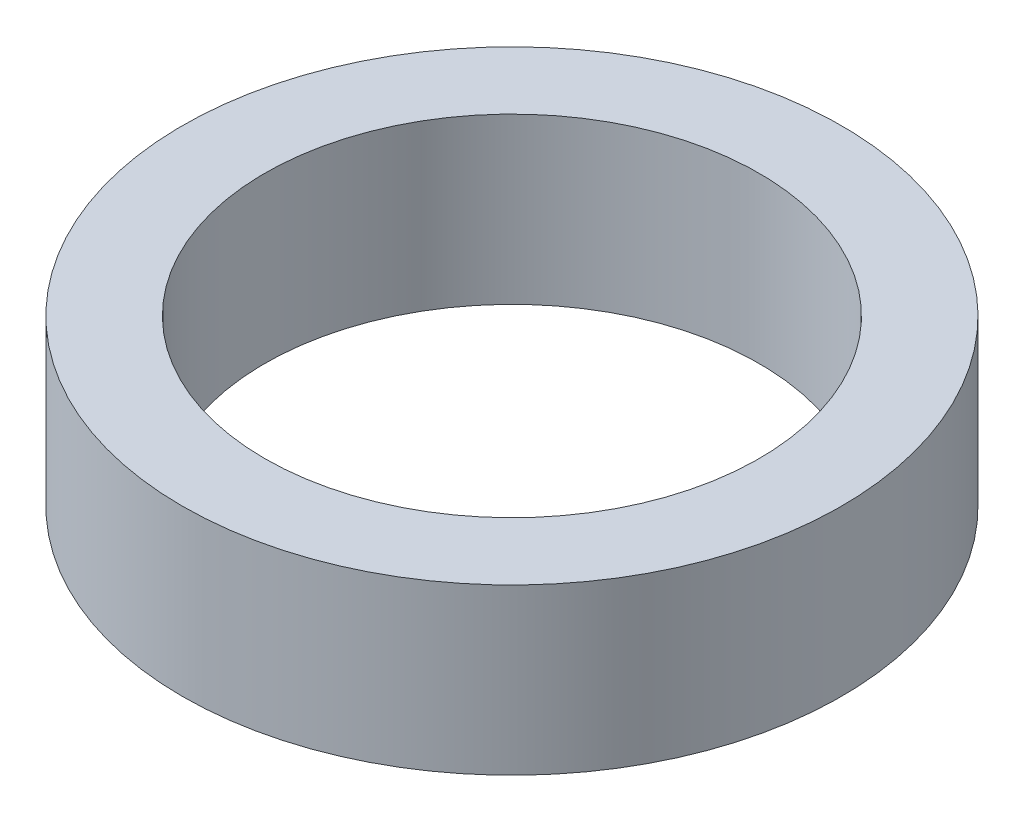
from build123d import *

# Parameters (mm, degrees)
SKETCH1_R           = 4
SKETCH1_R_2         = 3
BOSS_EXTRUDE1_DEPTH = 2


with BuildPart() as part:
    # Sketch1 → Boss-Extrude1 (new body)
    with BuildSketch(Plane(origin=(0, 0, 0), x_dir=(1, 0, 0), z_dir=(0, 1, 0))):
        Circle(SKETCH1_R)
        Circle(SKETCH1_R_2, mode=Mode.SUBTRACT)
    extrude(amount=BOSS_EXTRUDE1_DEPTH)


solid = part.part
